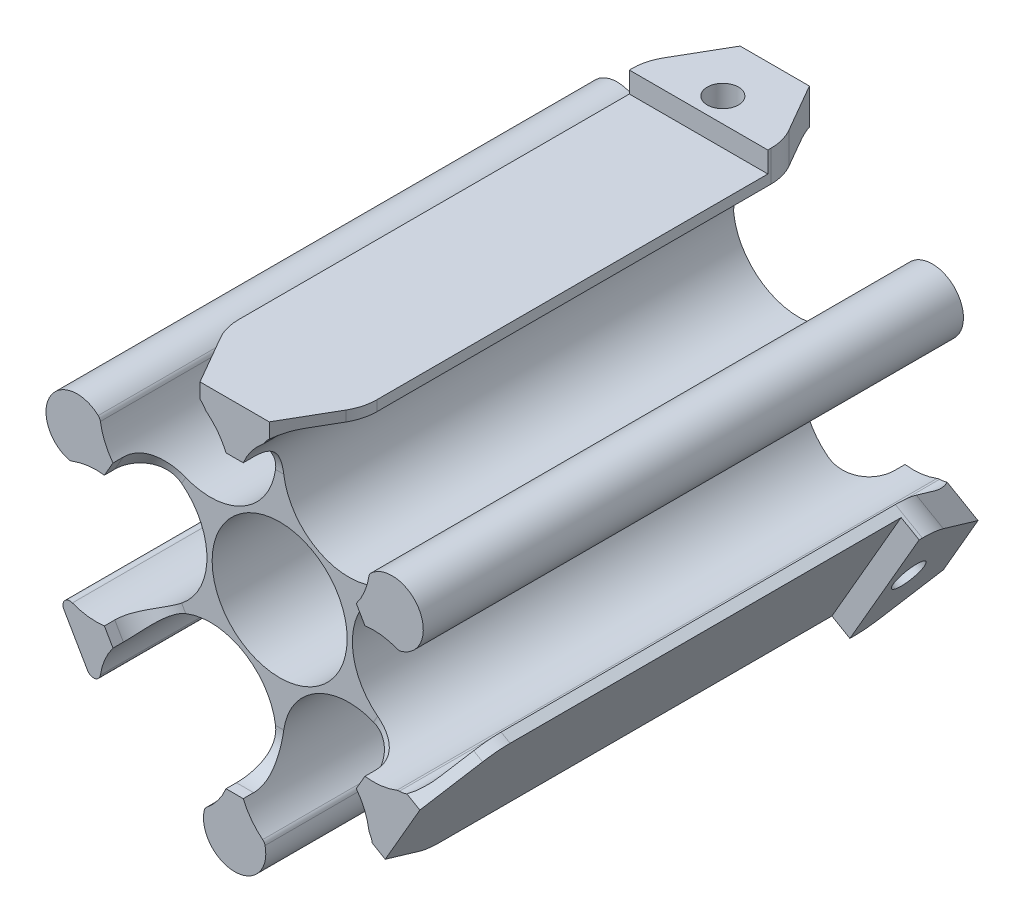
from build123d import *
from OCP.BRepFilletAPI import BRepFilletAPI_MakeChamfer

# Parameters (mm, degrees)
SKETCH_1_R               = 9.75
EXTRUDE_1_DEPTH          = 78
FILLET_1_R               = 1
CUT_EXTRUDE_2_DEPTH      = 6.5
FILLET_2_R               = 5
CUT_EXTRUDE_3_DEPTH      = 6.5
FILLET_3_R               = 5
SKETCH_9_W               = 20
SKETCH_9_H               = 78
EXTRUDE_4_DEPTH          = 1.5
PATTERN_CIRCULAR_6_COUNT = 3
FILLET_4_DEPTH           = 78
SKETCH_11_W              = 11
SKETCH_11_H              = 20
EXTRUDE_5_DEPTH          = 3
PATTERN_CIRCULAR_7_COUNT = 3
CHAMFER_3_SIZE           = 5
CHAMFER_3_SIZE2          = 8.660254038
CHAMFER_4_SIZE           = 5
CHAMFER_4_SIZE2          = 8.660254038
SKETCH_13_R              = 2.25
CUT_EXTRUDE_6_DEPTH      = 6
PATTERN_CIRCULAR_8_COUNT = 3
FILLET_5_R               = 7
EXTRUDE_START            = -78
EXTRUDE_6_DEPTH          = 78
SKETCH_15_R              = 2.25
CUT_EXTRUDE_7_DEPTH      = 6


with BuildPart() as part:
    # Эскиз1 → Бобышка-Вытянуть1 (new body)
    with BuildSketch(Plane.XY):
        with BuildLine():
            ThreePointArc((-0.5, 17.320508076), (-11.246135967, 7.902591897), (-19.17308319, 19.791245777))
            Line((-19.17308319, 19.791245777), (-26.726263211, 6.708754223))
            ThreePointArc((-26.726263211, 6.708754223), (-16.370227314, 8.779222645), (-10.5, 0))
            ThreePointArc((-10.5, 0), (-16.370227314, -8.779222645), (-26.726263211, -6.708754223))
            Line((-26.726263211, -6.708754223), (-19.17308319, -19.791245777))
            ThreePointArc((-19.17308319, -19.791245777), (-11.246135967, -7.902591897), (-0.5, -17.320508076))
            ThreePointArc((-0.5, -17.320508076), (-2.466913322, -23.108651569), (-7.553180021, -26.5))
            Line((-7.553180021, -26.5), (7.553180021, -26.5))
            ThreePointArc((7.553180021, -26.5), (4.211856507, -9.787421397), (19.5, -17.320508076))
            ThreePointArc((19.5, -17.320508076), (19.417916179, -18.566644042), (19.17308319, -19.791245777))
            Line((19.17308319, -19.791245777), (26.726263211, -6.708754223))
            ThreePointArc((26.726263211, -6.708754223), (10.5, 0), (26.726263211, 6.708754223))
            Line((26.726263211, 6.708754223), (19.17308319, 19.791245777))
            ThreePointArc((19.17308319, 19.791245777), (19.417916179, 18.566644042), (19.5, 17.320508076))
            ThreePointArc((19.5, 17.320508076), (4.211856507, 9.787421397), (7.553180021, 26.5))
            Line((7.553180021, 26.5), (-7.553180021, 26.5))
            ThreePointArc((-7.553180021, 26.5), (-2.466913322, 23.108651569), (-0.5, 17.320508076))
        make_face()
        Circle(SKETCH_1_R, mode=Mode.SUBTRACT)
    extrude(amount=EXTRUDE_1_DEPTH)

    # Скругление1
    fillet_1_edges = [part.edges().sort_by_distance(p)[0] for p in [
        (-26.726263211, 6.708754223, 39),
        (-19.17308319, 19.791245777, 39),
        (-7.553180021, 26.5, 39),
        (7.553180021, 26.5, 39),
        (19.17308319, 19.791245777, 39),
        (26.726263211, 6.708754223, 39),
        (26.726263211, -6.708754223, 39),
        (19.17308319, -19.791245777, 39),
        (7.553180021, -26.5, 39),
        (-7.553180021, -26.5, 39),
        (-19.17308319, -19.791245777, 39),
        (-26.726263211, -6.708754223, 39),
    ]]
    fillet(fillet_1_edges, radius=FILLET_1_R)

    # Эскиз4 → Вырез-Вытянуть2 (cut)
    with BuildSketch(Plane(origin=(0, 0, 0), x_dir=(-1, 0, 0), z_dir=(0, 0, -1))):
        Polygon((-24.248711306, 0), (-12.124355653, -21), (12.124355653, -21), (24.248711306, 0), (12.124355653, 21), (-12.124355653, 21), align=None)
    extrude(amount=-CUT_EXTRUDE_2_DEPTH, mode=Mode.SUBTRACT)

    # Скругление2
    # the kernel refuses this fillet: 5 mm, written as the material it adds along each edge
    with BuildSketch(Plane(origin=(-11.315783963, -22.400487249, 6.5), x_dir=(0.8660254037844387, 0.49999999999999967, 0), z_dir=(-0.4999999999999997, 0.8660254037844388, 0))) as fillet_2_piece_1_section:
        with BuildLine():
            CenterArc((FILLET_2_R, FILLET_2_R), FILLET_2_R, 180, 90)
            Line((0, FILLET_2_R), (0, 0))
            Line((0, 0), (FILLET_2_R, 0))
        make_face()
    fillet_2_piece_1 = extrude(amount=27.482998067, mode=Mode.PRIVATE)
    fillet_2_piece_1 = fillet_2_piece_1 - Plane(origin=(-10, -17.320508076, 6.5), x_dir=(-0.9655877042082922, -0.26007765279192985, 0), z_dir=(0, 0, -1)) * Cylinder(9.5, 75, mode=Mode.PRIVATE)
    fillet_2_piece_1 = fillet_2_piece_1 - Plane(origin=(-20, 0, 6.5), x_dir=(-0.7080277063785602, 0.7061846550303366, 0), z_dir=(0, 0, -1)) * Cylinder(9.5, 75, mode=Mode.PRIVATE)
    add(fillet_2_piece_1)
    with BuildSketch(Plane(origin=(13.741499034, -21, 6.5), x_dir=(0, 0, -1), z_dir=(-1, 0, 0))) as fillet_2_piece_2_section:
        with BuildLine():
            CenterArc((FILLET_2_R, -FILLET_2_R), FILLET_2_R, 90, 90)
            Line((0, -FILLET_2_R), (0, 0))
            Line((0, 0), (FILLET_2_R, 0))
        make_face()
    fillet_2_piece_2 = extrude(amount=27.482998067, mode=Mode.PRIVATE)
    fillet_2_piece_2 = fillet_2_piece_2 - Plane(origin=(-10, -17.320508076, 6.5), x_dir=(-0.9655877042082922, -0.26007765279192985, 0), z_dir=(0, 0, -1)) * Cylinder(9.5, 75, mode=Mode.PRIVATE)
    fillet_2_piece_2 = fillet_2_piece_2 - Plane(origin=(10, -17.320508076, 6.5), x_dir=(-0.25755999782971145, -0.9662623078222389, 0), z_dir=(0, 0, -1)) * Cylinder(9.5, 75, mode=Mode.PRIVATE)
    add(fillet_2_piece_2)
    with BuildSketch(Plane(origin=(25.057282996, 1.400487249, 6.5), x_dir=(-0.8660254037844386, 0.4999999999999999, 0), z_dir=(-0.5, -0.8660254037844387, 0))) as fillet_2_piece_3_section:
        with BuildLine():
            CenterArc((FILLET_2_R, FILLET_2_R), FILLET_2_R, 180, 90)
            Line((0, FILLET_2_R), (0, 0))
            Line((0, 0), (FILLET_2_R, 0))
        make_face()
    fillet_2_piece_3 = extrude(amount=27.482998067, mode=Mode.PRIVATE)
    fillet_2_piece_3 = fillet_2_piece_3 - Plane(origin=(10, -17.320508076, 6.5), x_dir=(-0.25755999782971145, -0.9662623078222389, 0), z_dir=(0, 0, -1)) * Cylinder(9.5, 75, mode=Mode.PRIVATE)
    fillet_2_piece_3 = fillet_2_piece_3 - Plane(origin=(20, 0, 6.5), x_dir=(0.7080277063785567, -0.7061846550303401, 0), z_dir=(0, 0, -1)) * Cylinder(9.5, 75, mode=Mode.PRIVATE)
    add(fillet_2_piece_3)
    with BuildSketch(Plane(origin=(11.315783963, 22.400487249, 6.5), x_dir=(-0.8660254037844389, -0.49999999999999967, 0), z_dir=(0.49999999999999967, -0.8660254037844389, 0))) as fillet_2_piece_4_section:
        with BuildLine():
            CenterArc((FILLET_2_R, FILLET_2_R), FILLET_2_R, 180, 90)
            Line((0, FILLET_2_R), (0, 0))
            Line((0, 0), (FILLET_2_R, 0))
        make_face()
    fillet_2_piece_4 = extrude(amount=27.482998067, mode=Mode.PRIVATE)
    fillet_2_piece_4 = fillet_2_piece_4 - Plane(origin=(20, 0, 6.5), x_dir=(0.7080277063785567, -0.7061846550303401, 0), z_dir=(0, 0, -1)) * Cylinder(9.5, 75, mode=Mode.PRIVATE)
    fillet_2_piece_4 = fillet_2_piece_4 - Plane(origin=(10, 17.320508076, 6.5), x_dir=(0.9655877042082929, 0.2600776527919273, 0), z_dir=(0, 0, -1)) * Cylinder(9.5, 75, mode=Mode.PRIVATE)
    add(fillet_2_piece_4)
    with BuildSketch(Plane(origin=(-13.741499034, 21, 6.5), x_dir=(0, -1, 0), z_dir=(1, 0, 0))) as fillet_2_piece_5_section:
        with BuildLine():
            CenterArc((FILLET_2_R, FILLET_2_R), FILLET_2_R, 180, 90)
            Line((0, FILLET_2_R), (0, 0))
            Line((0, 0), (FILLET_2_R, 0))
        make_face()
    fillet_2_piece_5 = extrude(amount=27.482998067, mode=Mode.PRIVATE)
    fillet_2_piece_5 = fillet_2_piece_5 - Plane(origin=(10, 17.320508076, 6.5), x_dir=(0.9655877042082929, 0.2600776527919273, 0), z_dir=(0, 0, -1)) * Cylinder(9.5, 75, mode=Mode.PRIVATE)
    fillet_2_piece_5 = fillet_2_piece_5 - Plane(origin=(-10, 17.320508076, 6.5), x_dir=(0.25755999782976996, 0.9662623078222233, 0), z_dir=(0, 0, -1)) * Cylinder(9.5, 75, mode=Mode.PRIVATE)
    add(fillet_2_piece_5)
    with BuildSketch(Plane(origin=(-25.057282996, -1.400487249, 6.5), x_dir=(0.8660254037844384, -0.5000000000000003, 0), z_dir=(0.5000000000000004, 0.8660254037844385, 0))) as fillet_2_piece_6_section:
        with BuildLine():
            CenterArc((FILLET_2_R, FILLET_2_R), FILLET_2_R, 180, 90)
            Line((0, FILLET_2_R), (0, 0))
            Line((0, 0), (FILLET_2_R, 0))
        make_face()
    fillet_2_piece_6 = extrude(amount=27.482998067, mode=Mode.PRIVATE)
    fillet_2_piece_6 = fillet_2_piece_6 - Plane(origin=(-20, 0, 6.5), x_dir=(-0.7080277063785602, 0.7061846550303366, 0), z_dir=(0, 0, -1)) * Cylinder(9.5, 75, mode=Mode.PRIVATE)
    fillet_2_piece_6 = fillet_2_piece_6 - Plane(origin=(-10, 17.320508076, 6.5), x_dir=(0.25755999782976996, 0.9662623078222233, 0), z_dir=(0, 0, -1)) * Cylinder(9.5, 75, mode=Mode.PRIVATE)
    add(fillet_2_piece_6)

    # Эскиз5 → Вырез-Вытянуть3 (cut)
    with BuildSketch(Plane.XY.offset(78)):
        Polygon((12.124355653, -21), (24.248711306, 0), (12.124355653, 21), (-12.124355653, 21), (-24.248711306, 0), (-12.124355653, -21), align=None)
    extrude(amount=-CUT_EXTRUDE_3_DEPTH, mode=Mode.SUBTRACT)

    # Скругление3
    # the kernel refuses this fillet: 5 mm, written as the material it adds along each edge
    with BuildSketch(Plane(origin=(25.057282996, -1.400487249, 71.5), x_dir=(-0.8660254037844389, -0.49999999999999967, 0), z_dir=(-0.49999999999999967, 0.8660254037844389, 0))) as fillet_3_piece_1_section:
        with BuildLine():
            CenterArc((FILLET_3_R, FILLET_3_R), FILLET_3_R, 180, 90)
            Line((0, FILLET_3_R), (0, 0))
            Line((0, 0), (FILLET_3_R, 0))
        make_face()
    fillet_3_piece_1 = extrude(amount=27.482998067, mode=Mode.PRIVATE)
    fillet_3_piece_1 = fillet_3_piece_1 - Plane(origin=(10, 17.320508076, 71.5), x_dir=(0.9655877042082548, 0.2600776527920686, 0), z_dir=(0, 0, -1)) * Cylinder(9.5, 75, mode=Mode.PRIVATE)
    fillet_3_piece_1 = fillet_3_piece_1 - Plane(origin=(20, 0, 71.5), x_dir=(0.7080277063789479, -0.706184655029948, 0), z_dir=(0, 0, -1)) * Cylinder(9.5, 75, mode=Mode.PRIVATE)
    add(fillet_3_piece_1)
    with BuildSketch(Plane(origin=(11.315783963, -22.400487249, 71.5), x_dir=(-0.8660254037844387, 0.5, 0), z_dir=(0.5, 0.8660254037844387, 0))) as fillet_3_piece_2_section:
        with BuildLine():
            CenterArc((FILLET_3_R, FILLET_3_R), FILLET_3_R, 180, 90)
            Line((0, FILLET_3_R), (0, 0))
            Line((0, 0), (FILLET_3_R, 0))
        make_face()
    fillet_3_piece_2 = extrude(amount=27.482998067, mode=Mode.PRIVATE)
    fillet_3_piece_2 = fillet_3_piece_2 - Plane(origin=(10, -17.320508076, 71.5), x_dir=(-0.2575599978300403, -0.9662623078221512, 0), z_dir=(0, 0, -1)) * Cylinder(9.5, 75, mode=Mode.PRIVATE)
    fillet_3_piece_2 = fillet_3_piece_2 - Plane(origin=(20, 0, 71.5), x_dir=(0.7080277063789479, -0.706184655029948, 0), z_dir=(0, 0, -1)) * Cylinder(9.5, 75, mode=Mode.PRIVATE)
    add(fillet_3_piece_2)
    with BuildSketch(Plane(origin=(-13.741499034, -21, 71.5), x_dir=(0, 1, 0), z_dir=(1, 0, 0))) as fillet_3_piece_3_section:
        with BuildLine():
            CenterArc((FILLET_3_R, FILLET_3_R), FILLET_3_R, 180, 90)
            Line((0, FILLET_3_R), (0, 0))
            Line((0, 0), (FILLET_3_R, 0))
        make_face()
    fillet_3_piece_3 = extrude(amount=27.482998067, mode=Mode.PRIVATE)
    fillet_3_piece_3 = fillet_3_piece_3 - Plane(origin=(10, -17.320508076, 71.5), x_dir=(-0.2575599978300403, -0.9662623078221512, 0), z_dir=(0, 0, -1)) * Cylinder(9.5, 75, mode=Mode.PRIVATE)
    fillet_3_piece_3 = fillet_3_piece_3 - Plane(origin=(-10, -17.320508076, 71.5), x_dir=(-0.9655877042082548, -0.2600776527920686, 0), z_dir=(0, 0, -1)) * Cylinder(9.5, 75, mode=Mode.PRIVATE)
    add(fillet_3_piece_3)
    with BuildSketch(Plane(origin=(-25.057282996, 1.400487249, 71.5), x_dir=(0, 0, 1), z_dir=(0.4999999999999997, -0.8660254037844388, 0))) as fillet_3_piece_4_section:
        with BuildLine():
            CenterArc((FILLET_3_R, -FILLET_3_R), FILLET_3_R, 90, 90)
            Line((0, -FILLET_3_R), (0, 0))
            Line((0, 0), (FILLET_3_R, 0))
        make_face()
    fillet_3_piece_4 = extrude(amount=27.482998067, mode=Mode.PRIVATE)
    fillet_3_piece_4 = fillet_3_piece_4 - Plane(origin=(-20, 0, 71.5), x_dir=(-0.7080277063789479, 0.706184655029948, 0), z_dir=(0, 0, -1)) * Cylinder(9.5, 75, mode=Mode.PRIVATE)
    fillet_3_piece_4 = fillet_3_piece_4 - Plane(origin=(-10, -17.320508076, 71.5), x_dir=(-0.9655877042082548, -0.2600776527920686, 0), z_dir=(0, 0, -1)) * Cylinder(9.5, 75, mode=Mode.PRIVATE)
    add(fillet_3_piece_4)
    with BuildSketch(Plane(origin=(-11.315783963, 22.400487249, 71.5), x_dir=(0.8660254037844385, -0.5000000000000004, 0), z_dir=(-0.5000000000000004, -0.8660254037844385, 0))) as fillet_3_piece_5_section:
        with BuildLine():
            CenterArc((FILLET_3_R, FILLET_3_R), FILLET_3_R, 180, 90)
            Line((0, FILLET_3_R), (0, 0))
            Line((0, 0), (FILLET_3_R, 0))
        make_face()
    fillet_3_piece_5 = extrude(amount=27.482998067, mode=Mode.PRIVATE)
    fillet_3_piece_5 = fillet_3_piece_5 - Plane(origin=(-20, 0, 71.5), x_dir=(-0.7080277063789479, 0.706184655029948, 0), z_dir=(0, 0, -1)) * Cylinder(9.5, 75, mode=Mode.PRIVATE)
    fillet_3_piece_5 = fillet_3_piece_5 - Plane(origin=(-10, 17.320508076, 71.5), x_dir=(0.2575599978300403, 0.9662623078221512, 0), z_dir=(0, 0, -1)) * Cylinder(9.5, 75, mode=Mode.PRIVATE)
    add(fillet_3_piece_5)
    with BuildSketch(Plane(origin=(13.741499034, 21, 71.5), x_dir=(0, -1, 0), z_dir=(-1, 0, 0))) as fillet_3_piece_6_section:
        with BuildLine():
            CenterArc((FILLET_3_R, FILLET_3_R), FILLET_3_R, 180, 90)
            Line((0, FILLET_3_R), (0, 0))
            Line((0, 0), (FILLET_3_R, 0))
        make_face()
    fillet_3_piece_6 = extrude(amount=27.482998067, mode=Mode.PRIVATE)
    fillet_3_piece_6 = fillet_3_piece_6 - Plane(origin=(-10, 17.320508076, 71.5), x_dir=(0.2575599978300403, 0.9662623078221512, 0), z_dir=(0, 0, -1)) * Cylinder(9.5, 75, mode=Mode.PRIVATE)
    fillet_3_piece_6 = fillet_3_piece_6 - Plane(origin=(10, 17.320508076, 71.5), x_dir=(0.9655877042082548, 0.2600776527920686, 0), z_dir=(0, 0, -1)) * Cylinder(9.5, 75, mode=Mode.PRIVATE)
    add(fillet_3_piece_6)

    # Эскиз9 → Бобышка-Вытянуть4 (add)
    with BuildSketch(Plane(origin=(0, 26.5, 0), x_dir=(1, 0, 0), z_dir=(0, 1, 0))):
        with Locations((0, -39)):
            Rectangle(SKETCH_9_W, SKETCH_9_H)
    extrude_4 = extrude(amount=EXTRUDE_4_DEPTH)

    # Круговой массив6: Бобышка-Вытянуть4 ×3 about axis, 1 skipped
    pattern_circular_6_axis = Axis((0, 0, 78), (0, 0, 1))
    add([extrude_4.rotate(pattern_circular_6_axis, i * 360 / PATTERN_CIRCULAR_6_COUNT) for i in range(1, PATTERN_CIRCULAR_6_COUNT) if i not in (1,)])

    # Скругление4: read off the stored shape, not the designer's step
    # Скругление4 outline → Скругление4 (add)
    with BuildSketch(Plane.XY):
        with BuildLine():
            ThreePointArc((21.241553812, -16.208549565), (20.375528409, -16.708549564), (19.509503005, -16.208549565))
            ThreePointArc((19.509503005, -16.208549565), (19.911426794, -17.708549565), (19.509503005, -19.208549565))
            Line((19.509503005, -19.208549565), (21.241553812, -16.208549565))
        make_face()
        with BuildLine():
            Line((24.657792588, -10.291450435), (26.389843396, -7.291450435))
            ThreePointArc((26.389843396, -7.291450435), (25.291767184, -8.389526646), (23.791767184, -8.791450435))
            ThreePointArc((23.791767184, -8.791450435), (24.657792588, -9.291450435), (24.657792588, -10.291450435))
        make_face()
        with BuildLine():
            Line((-3.416238776, 26.5), (-6.880340391, 26.5))
            ThreePointArc((-6.880340391, 26.5), (-5.380340391, 26.098076211), (-4.282264179, 25))
            ThreePointArc((-4.282264179, 25), (-4.282264179, 26), (-3.416238776, 26.5))
        make_face()
        with BuildLine():
            ThreePointArc((3.416238776, 26.5), (4.282264179, 26), (4.282264179, 25))
            ThreePointArc((4.282264179, 25), (5.380340391, 26.098076211), (6.880340391, 26.5))
            Line((6.880340391, 26.5), (3.416238776, 26.5))
        make_face()
    extrude(amount=FILLET_4_DEPTH)

    # Эскиз11 → Бобышка-Вытянуть5 (add)
    with BuildSketch(Plane(origin=(24.248711306, -14, 0), x_dir=(0, 0, -1), z_dir=(0.8660254037844433, -0.4999999999999923, 0))):
        with Locations((-5.5, 0)):
            Rectangle(SKETCH_11_W, SKETCH_11_H)
    extrude_5 = extrude(amount=EXTRUDE_5_DEPTH)

    # Круговой массив7: Бобышка-Вытянуть5 ×3 about axis, 1 skipped
    pattern_circular_7_axis = Axis((0, 0, 78), (0, 0, 1))
    add([extrude_5.rotate(pattern_circular_7_axis, i * 360 / PATTERN_CIRCULAR_7_COUNT) for i in range(1, PATTERN_CIRCULAR_7_COUNT) if i not in (2,)])

    # Фаска3: one chamfer whose edges measure the first distance from different faces: ONE call of the kernel's chamfer builder (chamfer() names one face for all edges)
    chamfer_3_edges_1 = [part.edges().sort_by_distance(p)[0] for p in [
        (-10, 28.75, 0),
    ]]
    chamfer_3_side_1 = [part.faces().sort_by_distance(p)[0] for p in [
        (0, 27.53297258, 0),
    ]]
    chamfer_3_edges_2 = [part.edges().sort_by_distance(p)[0] for p in [
        (10, 27.25, 78),
    ]]
    chamfer_3_side_2 = [part.faces().sort_by_distance(p)[0] for p in [
        (0, 25.725684777, 78),
    ]]
    chamfer_3_edges_3 = [part.edges().sort_by_distance(p)[0] for p in [
        (29.898230359, -5.714745962, 0),
    ]]
    chamfer_3_side_3 = [part.faces().sort_by_distance(p)[0] for p in [
        (23.844253696, -13.76648629, 0),
    ]]
    chamfer_3_edges_4 = [part.edges().sort_by_distance(p)[0] for p in [
        (18.599192253, -22.285254038, 78),
    ]]
    chamfer_3_side_4 = [part.faces().sort_by_distance(p)[0] for p in [
        (22.279096546, -12.862842388, 78),
    ]]
    chamfer_3 = BRepFilletAPI_MakeChamfer(part.part.solid().wrapped)
    for e in chamfer_3_edges_1:
        chamfer_3.Add(CHAMFER_3_SIZE, CHAMFER_3_SIZE2, e.wrapped, chamfer_3_side_1[0].wrapped)  # the first distance lies on this face
    for e in chamfer_3_edges_2:
        chamfer_3.Add(CHAMFER_3_SIZE, CHAMFER_3_SIZE2, e.wrapped, chamfer_3_side_2[0].wrapped)  # the first distance lies on this face
    for e in chamfer_3_edges_3:
        chamfer_3.Add(CHAMFER_3_SIZE, CHAMFER_3_SIZE2, e.wrapped, chamfer_3_side_3[0].wrapped)  # the first distance lies on this face
    for e in chamfer_3_edges_4:
        chamfer_3.Add(CHAMFER_3_SIZE, CHAMFER_3_SIZE2, e.wrapped, chamfer_3_side_4[0].wrapped)  # the first distance lies on this face
    add(Compound.cast(chamfer_3.Shape()), mode=Mode.REPLACE)

    # Фаска4: one chamfer whose edges measure the first distance from different faces: ONE call of the kernel's chamfer builder (chamfer() names one face for all edges)
    chamfer_4_edges_1 = [part.edges().sort_by_distance(p)[0] for p in [
        (10, 28.75, 0),
    ]]
    chamfer_4_side_1 = [part.faces().sort_by_distance(p)[0] for p in [
        (1.668868734, 27.270313738, 0),
    ]]
    chamfer_4_edges_2 = [part.edges().sort_by_distance(p)[0] for p in [
        (-10, 27.25, 78),
    ]]
    chamfer_4_side_2 = [part.faces().sort_by_distance(p)[0] for p in [
        (-1.017378688, 25.522553225, 78),
    ]]
    chamfer_4_edges_3 = [part.edges().sort_by_distance(p)[0] for p in [
        (19.898230359, -23.035254038, 0),
    ]]
    chamfer_4_side_3 = [part.faces().sort_by_distance(p)[0] for p in [
        (22.782350099, -15.080439588, 0),
    ]]
    chamfer_4_edges_4 = [part.edges().sort_by_distance(p)[0] for p in [
        (28.599192253, -4.964745962, 78),
    ]]
    chamfer_4_side_4 = [part.faces().sort_by_distance(p)[0] for p in [
        (22.611868807, -11.880200824, 78),
    ]]
    chamfer_4 = BRepFilletAPI_MakeChamfer(part.part.solid().wrapped)
    for e in chamfer_4_edges_1:
        chamfer_4.Add(CHAMFER_4_SIZE, CHAMFER_4_SIZE2, e.wrapped, chamfer_4_side_1[0].wrapped)  # the first distance lies on this face
    for e in chamfer_4_edges_2:
        chamfer_4.Add(CHAMFER_4_SIZE, CHAMFER_4_SIZE2, e.wrapped, chamfer_4_side_2[0].wrapped)  # the first distance lies on this face
    for e in chamfer_4_edges_3:
        chamfer_4.Add(CHAMFER_4_SIZE, CHAMFER_4_SIZE2, e.wrapped, chamfer_4_side_3[0].wrapped)  # the first distance lies on this face
    for e in chamfer_4_edges_4:
        chamfer_4.Add(CHAMFER_4_SIZE, CHAMFER_4_SIZE2, e.wrapped, chamfer_4_side_4[0].wrapped)  # the first distance lies on this face
    add(Compound.cast(chamfer_4.Shape()), mode=Mode.REPLACE)

    # Эскиз13 → Вырез-Вытянуть6 (cut)
    with BuildSketch(Plane(origin=(26.846787517, -15.5, 0), x_dir=(0, 0, -1), z_dir=(0.866025403784443, -0.49999999999999234, 0))):
        with Locations(Location((-7.5, 0, 0), (0, 0, 90))):
            Circle(SKETCH_13_R)
    cut_extrude_6 = extrude(amount=-CUT_EXTRUDE_6_DEPTH, mode=Mode.SUBTRACT)

    # Круговой массив8: Вырез-Вытянуть6 ×3 about axis, 1 skipped
    pattern_circular_8_axis = Axis((0, 0, 78), (0, 0, 1))
    add([cut_extrude_6.rotate(pattern_circular_8_axis, i * 360 / PATTERN_CIRCULAR_8_COUNT) for i in range(1, PATTERN_CIRCULAR_8_COUNT) if i not in (2,)], mode=Mode.SUBTRACT)

    # Скругление5
    fillet_5_edges = [part.edges().sort_by_distance(p)[0] for p in [
        (18.599192253, -22.285254038, 69.339745962),
        (10, 27.25, 69.339745962),
        (-10, 28.75, 8.660254038),
        (29.898230359, -5.714745962, 8.660254038),
        (-10, 27.25, 69.339745962),
        (10, 28.75, 8.660254038),
        (19.898230359, -23.035254038, 8.660254038),
        (28.599192253, -4.964745962, 69.339745962),
    ]]
    fillet(fillet_5_edges, radius=FILLET_5_R)

    # Эскиз14 → Бобышка-Вытянуть6 (add)
    with BuildSketch(Plane(origin=(0, 0, 0), x_dir=(-1, 0, 0), z_dir=(0, 0, -1)).offset(EXTRUDE_START)):
        with BuildLine():
            Line((-21.241553812, 16.208549565), (-24.657792588, 10.291450435))
            ThreePointArc((-24.657792588, 10.291450435), (-24.723584657, 9.428523173), (-24.091471478, 8.837418288))
            ThreePointArc((-24.091471478, 8.837418288), (-26.639916474, 15.380562948), (-19.699164481, 16.44511717))
            ThreePointArc((-19.699164481, 16.44511717), (-20.527132916, 16.696990799), (-21.241553812, 16.208549565))
        make_face()
        with BuildLine():
            Line((-3.416238776, -26.5), (3.416238776, -26.5))
            ThreePointArc((3.416238776, -26.5), (4.196451741, -26.125513972), (4.392306997, -25.282535459))
            ThreePointArc((4.392306997, -25.282535459), (0, -30.761125895), (-4.392306997, -25.282535459))
            ThreePointArc((-4.392306997, -25.282535459), (-4.196451741, -26.125513972), (-3.416238776, -26.5))
        make_face()
        with BuildLine():
            Line((24.657792588, 10.291450435), (21.241553812, 16.208549565))
            ThreePointArc((21.241553812, 16.208549565), (20.527132916, 16.696990799), (19.699164481, 16.44511717))
            ThreePointArc((19.699164481, 16.44511717), (26.639916474, 15.380562948), (24.091471478, 8.837418288))
            ThreePointArc((24.091471478, 8.837418288), (24.723584657, 9.428523173), (24.657792588, 10.291450435))
        make_face()
    extrude(amount=EXTRUDE_6_DEPTH)

    # Эскиз15 → Вырез-Вытянуть7 (cut)
    with BuildSketch(Plane(origin=(0, 0, 0), x_dir=(-1, 0, 0), z_dir=(0, 0, -1))):
        with Locations((-22.741827103, 13.13)):
            Circle(SKETCH_15_R)
        with Locations((22.741827103, 13.13)):
            Circle(SKETCH_15_R)
        with Locations((0, -26.26)):
            Circle(SKETCH_15_R)
    extrude(amount=-CUT_EXTRUDE_7_DEPTH, mode=Mode.SUBTRACT)


solid = part.part
